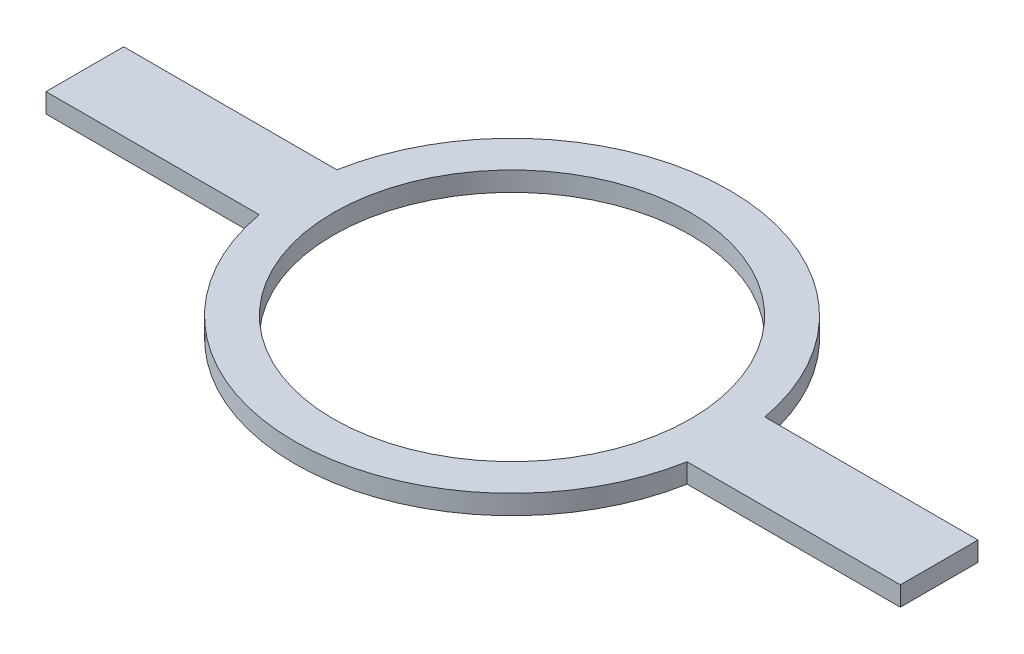
from build123d import *

# Parameters (mm, degrees)
SKETCH1_R           = 58.42
BOSS_EXTRUDE1_DEPTH = 6.35


with BuildPart() as part:
    # Sketch1 → Boss-Extrude1 (new body)
    with BuildSketch(Plane(origin=(0, 0, 0), x_dir=(1, 0, 0), z_dir=(0, 1, 0))):
        with BuildLine():
            Line((69.976884755, 12.7), (139.7, 12.7))
            Line((139.7, 12.7), (139.7, -12.7))
            Line((139.7, -12.7), (69.976884755, -12.7))
            ThreePointArc((69.976884755, -12.7), (0, -71.12), (-69.976884755, -12.7))
            Line((-69.976884755, -12.7), (-139.7, -12.7))
            Line((-139.7, -12.7), (-139.7, 12.7))
            Line((-139.7, 12.7), (-69.976884755, 12.7))
            ThreePointArc((-69.976884755, 12.7), (0, 71.12), (69.976884755, 12.7))
        make_face()
        Circle(SKETCH1_R, mode=Mode.SUBTRACT)
    extrude(amount=BOSS_EXTRUDE1_DEPTH)


solid = part.part
